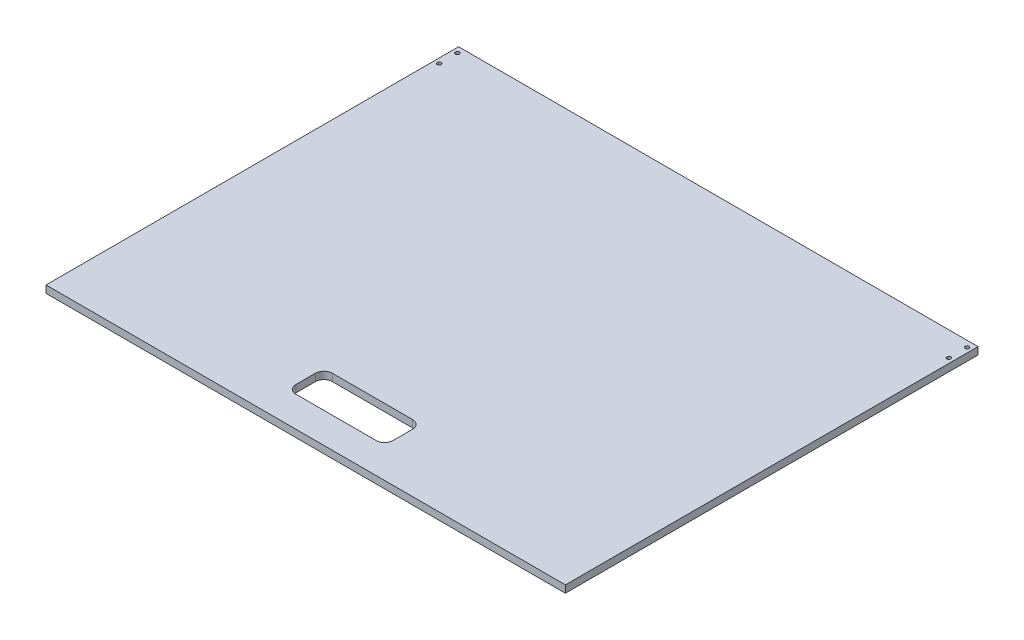
from build123d import *

# Parameters (mm, degrees)
SKETCH1_W           = 428
SKETCH1_H           = 340
BOSS_EXTRUDE1_DEPTH = 6
SKETCH2_R           = 1.6
CUT_EXTRUDE1_DEPTH  = 274.371542045
CUT_EXTRUDE2_DEPTH  = 274.371542045


with BuildPart() as part:
    # Sketch1 → Boss-Extrude1 (new body)
    with BuildSketch(Plane(origin=(0, 0, 0), x_dir=(1, 0, 0), z_dir=(0, 1, 0))):
        Rectangle(SKETCH1_W, SKETCH1_H)
    extrude(amount=BOSS_EXTRUDE1_DEPTH)

    # Sketch2 → Cut-Extrude1 (cut, through all)
    with BuildSketch(Plane.XZ):
        with Locations((210, -150)):
            Circle(SKETCH2_R)
        with Locations((210, -165)):
            Circle(SKETCH2_R)
    cut_extrude1 = extrude(amount=-CUT_EXTRUDE1_DEPTH, mode=Mode.SUBTRACT)

    # Mirror1: Cut-Extrude1 across plane
    add(cut_extrude1.mirror(Plane(origin=(0, 0, 0), x_dir=(0, 0, 1), z_dir=(1, 0, 0))), mode=Mode.SUBTRACT)

    # Sketch3 → Cut-Extrude2 (cut, through all)
    with BuildSketch(Plane(origin=(0, 6, 0), x_dir=(1, 0, 0), z_dir=(0, 1, 0))):
        with BuildLine():
            Line((-33, -145), (33, -145))
            ThreePointArc((33, -145), (37.949747468, -142.949747468), (40, -138))
            Line((40, -138), (40, -122))
            ThreePointArc((40, -122), (37.949747468, -117.050252532), (33, -115))
            Line((33, -115), (-33, -115))
            ThreePointArc((-33, -115), (-37.949747468, -117.050252532), (-40, -122))
            Line((-40, -122), (-40, -138))
            ThreePointArc((-40, -138), (-37.949747468, -142.949747468), (-33, -145))
        make_face()
    extrude(amount=-CUT_EXTRUDE2_DEPTH, mode=Mode.SUBTRACT)


solid = part.part
